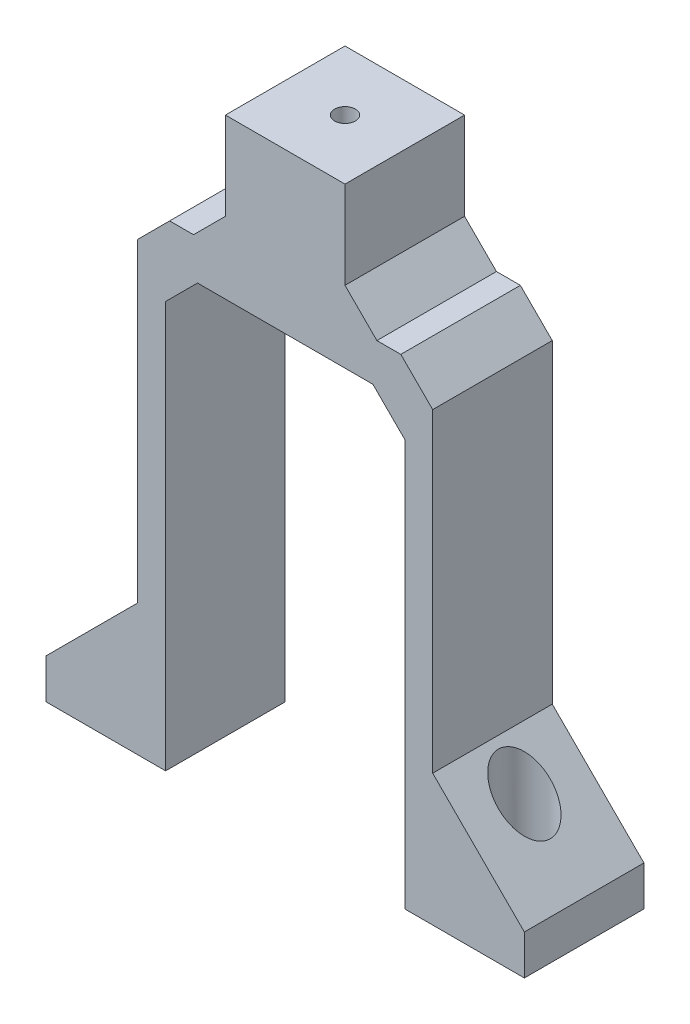
from build123d import *

# Parameters (mm, degrees)
SKETCH1_W             = 15
SKETCH1_H             = 15
SKETCH1_R             = 1.875
BOSS_EXTRUDE1_DEPTH   = 5
BOSS_EXTRUDE1_2_DEPTH = 5
SKETCH2_W             = 3.5
SKETCH2_H             = 15
BOSS_EXTRUDE2_DEPTH   = 50
SKETCH4_W             = 37
SKETCH4_H             = 15
BOSS_EXTRUDE3_DEPTH   = 5
SKETCH5_W             = 15
SKETCH5_H             = 15
BOSS_EXTRUDE4_DEPTH   = 15
SKETCH6_R             = 1.3
CUT_EXTRUDE1_DEPTH    = 82.124903698
CHAMFER1_SIZE         = 4
SKETCH7_R             = 3.25
CUT_EXTRUDE2_DEPTH    = 2
CHAMFER2_SIZE         = 11.5


with BuildPart() as part:
    # Sketch1 → Boss-Extrude1 (new body)
    with BuildSketch(Plane(origin=(0, 0, 0), x_dir=(1, 0, 0), z_dir=(0, 1, 0))):
        with Locations((-22.5, 0)):
            Rectangle(SKETCH1_W, SKETCH1_H)
        with Locations(Location((-22.5, 0, 0), (0, 0, 270))):
            Circle(SKETCH1_R, mode=Mode.SUBTRACT)
    extrude(amount=BOSS_EXTRUDE1_DEPTH)



with BuildPart() as body_2:
    # Sketch1 → Boss-Extrude1 2 (new body)
    with BuildSketch(Plane(origin=(0, 0, 0), x_dir=(1, 0, 0), z_dir=(0, 1, 0))):
        with Locations((22.5, 0)):
            Rectangle(SKETCH1_W, SKETCH1_H)
        with Locations(Location((22.5, 0, 0), (0, 0, 270))):
            Circle(SKETCH1_R, mode=Mode.SUBTRACT)
    extrude(amount=BOSS_EXTRUDE1_2_DEPTH)


with BuildPart() as part_1:
    add(part.part)

    add(body_2.part)  # Boss-Extrude2 merges body 2
    # Sketch2 → Boss-Extrude2 (add)
    with BuildSketch(Plane(origin=(0, 5, 0), x_dir=(1, 0, 0), z_dir=(0, 1, 0))):
        with Locations((-16.75, 0)):
            Rectangle(SKETCH2_W, SKETCH2_H)
        with Locations((16.75, 0)):
            Rectangle(SKETCH2_W, SKETCH2_H)
    extrude(amount=BOSS_EXTRUDE2_DEPTH)

    # Sketch4 → Boss-Extrude3 (add)
    with BuildSketch(Plane(origin=(0, 55, 0), x_dir=(1, 0, 0), z_dir=(0, 1, 0))):
        Rectangle(SKETCH4_W, SKETCH4_H)
    extrude(amount=BOSS_EXTRUDE3_DEPTH)

    # Sketch5 → Boss-Extrude4 (add)
    with BuildSketch(Plane(origin=(0, 60, 0), x_dir=(1, 0, 0), z_dir=(0, 1, 0))):
        Rectangle(SKETCH5_W, SKETCH5_H)
    extrude(amount=BOSS_EXTRUDE4_DEPTH)

    # Sketch6 → Cut-Extrude1 (cut, through all)
    with BuildSketch(Plane(origin=(0, 75, 0), x_dir=(1, 0, 0), z_dir=(0, 1, 0))):
        with Locations(Location((0, 0, 0), (0, 0, 270))):
            Circle(SKETCH6_R)
    extrude(amount=-CUT_EXTRUDE1_DEPTH, mode=Mode.SUBTRACT)

    # Chamfer1
    chamfer1_edges = [part_1.edges().sort_by_distance(p)[0] for p in [
        (-15, 55, 0),
        (-18.5, 60, 0),
        (18.5, 60, 0),
        (15, 55, 0),
        (7.5, 60, 0),
        (-7.5, 60, 0),
    ]]
    chamfer(chamfer1_edges, length=CHAMFER1_SIZE)

    # Sketch7 → Cut-Extrude2 (cut)
    with BuildSketch(Plane(origin=(0, 5, 0), x_dir=(1, 0, 0), z_dir=(0, 1, 0))):
        with Locations(Location((-22.5, 0, 0), (0, 0, 270))):
            Circle(SKETCH7_R)
        with Locations(Location((22.5, 0, 0), (0, 0, 270))):
            Circle(SKETCH7_R)
    extrude(amount=-CUT_EXTRUDE2_DEPTH, mode=Mode.SUBTRACT)

    # Chamfer2
    # the kernel refuses this chamfer: 11.5 mm, written as the material it adds along each edge
    with BuildSketch(Plane(origin=(18.5, 5, 7.5), x_dir=(0.9996219169112968, -0.02749587661058638, 0), z_dir=(0, 0, -1))) as chamfer2_piece_1_section:
        Polygon((CHAMFER2_SIZE * 0.999621916911, -CHAMFER2_SIZE * 0.0274958766106), (-CHAMFER2_SIZE * 0.0274958766106, -CHAMFER2_SIZE * 0.999621916911), (0, 0), align=None)
    chamfer2_piece_1 = extrude(amount=15, mode=Mode.PRIVATE)
    chamfer2_piece_1 = split(chamfer2_piece_1, bisect_by=Plane(origin=(30, 6.904321088, -5), z_dir=(-1, 0, 0)), keep=Keep.TOP, mode=Mode.PRIVATE)
    chamfer2_piece_1 = chamfer2_piece_1 - Plane(origin=(22.5, 6.904321088, 0), x_dir=(0, 0, 1), z_dir=(0, 1, 0)) * Cylinder(3.25, 76, mode=Mode.PRIVATE)
    add(chamfer2_piece_1)
    with BuildSketch(Plane(origin=(-18.5, 5, -7.5), x_dir=(-0.9996219169112968, -0.02749587661058638, 0), z_dir=(0, 0, 1))) as chamfer2_piece_2_section:
        Polygon((CHAMFER2_SIZE * 0.999621916911, -CHAMFER2_SIZE * 0.0274958766106), (-CHAMFER2_SIZE * 0.0274958766106, -CHAMFER2_SIZE * 0.999621916911), (0, 0), align=None)
    chamfer2_piece_2 = extrude(amount=15, mode=Mode.PRIVATE)
    chamfer2_piece_2 = split(chamfer2_piece_2, bisect_by=Plane(origin=(-30, 6.90432124, 5), z_dir=(1, 0, 0)), keep=Keep.TOP, mode=Mode.PRIVATE)
    chamfer2_piece_2 = chamfer2_piece_2 - Plane(origin=(-22.5, 6.90432124, 0), x_dir=(0, 0, 1), z_dir=(0, 1, 0)) * Cylinder(3.25, 76, mode=Mode.PRIVATE)
    add(chamfer2_piece_2)


solid = part_1.part
